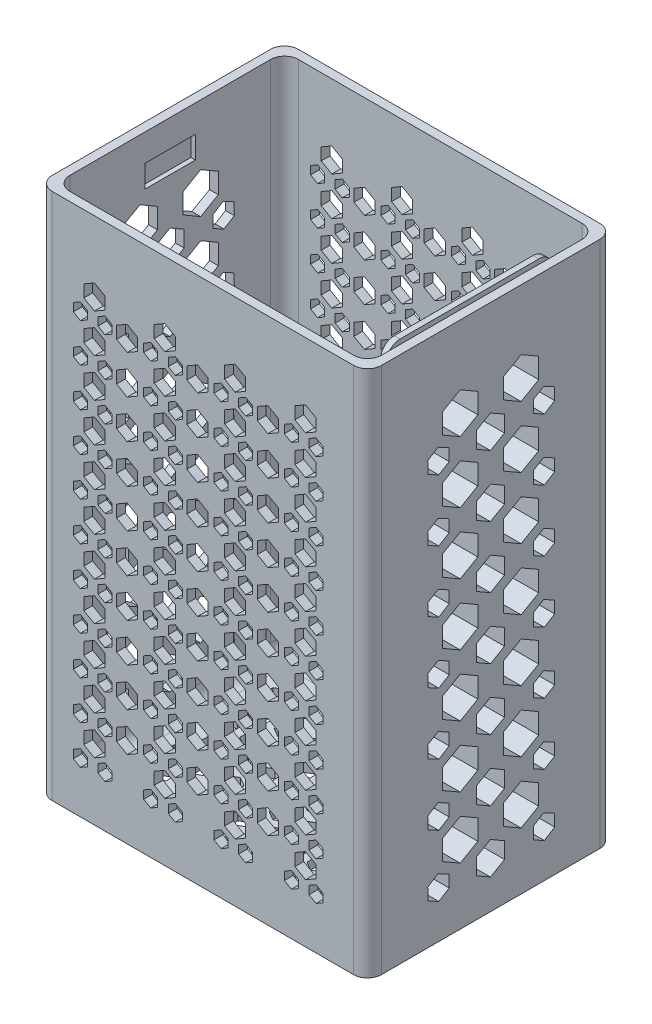
from build123d import *

# Parameters (mm, degrees)
SKETCH1_W                = 237.6932
SKETCH1_H                = 177.6984
SKETCH1_W_2              = 224.9932
SKETCH1_H_2              = 164.9984
BOSS_EXTRUDE1_DEPTH      = 374.65
SKETCH4_W                = 107.442
SKETCH4_H                = 374.65
BOSS_EXTRUDE2_DEPTH      = 9.017
SKETCH5_W                = 120.142
SKETCH5_H                = 374.65
BOSS_EXTRUDE3_DEPTH      = 4.191
SKETCH7_W                = 9.017
SKETCH7_H                = 107.442
CUT_EXTRUDE1_DEPTH       = 21.59
SKETCH10_W               = 4.191
SKETCH10_H               = 120.142
CUT_EXTRUDE2_DEPTH       = 5.588
FILLET1_R                = 10
FILLET2_R                = 10
FILLET3_R                = 10
FILLET4_R                = 10
FILLET5_R                = 10
FILLET6_R                = 10
FILLET7_R                = 10
SKETCH11_W               = 50.8
SKETCH11_H               = 15.24
BOSS_EXTRUDE4_DEPTH      = 19.9898
FILLET10_R               = 10
FILLET11_R               = 10
BOSS_EXTRUDE5_DEPTH      = 6.35
FILLET13_R               = 10
SKETCH13_W               = 36.3982
SKETCH13_H               = 16.129
CUT_EXTRUDE4_DEPTH       = 3.175
CUT_EXTRUDE5_DEPTH       = 6.35
CUT_EXTRUDE6_DEPTH       = 467.160768578
CUT_EXTRUDE6_DEPTH_BACK  = 467.160768578
CUT_EXTRUDE9_DEPTH       = 475.825252118
CUT_EXTRUDE9_DEPTH_BACK  = 475.825252118
CUT_EXTRUDE10_DEPTH      = 476.626906313
CUT_EXTRUDE10_DEPTH_BACK = 476.626906313
CUT_EXTRUDE11_DEPTH      = 476.626906313
CUT_EXTRUDE11_DEPTH_BACK = 476.626906313
CUT_EXTRUDE12_DEPTH      = 475.825252118
CUT_EXTRUDE12_DEPTH_BACK = 475.825252118


with BuildPart() as part:
    # Sketch1 → Boss-Extrude1 (new body)
    with BuildSketch(Plane(origin=(0, 0, 0), x_dir=(1, 0, 0), z_dir=(0, 1, 0))):
        with Locations((112.4966, -82.4992)):
            Rectangle(SKETCH1_W, SKETCH1_H)
        with Locations((112.4966, -82.4992)):
            Rectangle(SKETCH1_W_2, SKETCH1_H_2, mode=Mode.SUBTRACT)
    extrude(amount=BOSS_EXTRUDE1_DEPTH)

    # Sketch4 → Boss-Extrude2 (add)
    with BuildSketch(Plane.ZY.offset(-224.9932)):
        with Locations((82.4484, 187.325)):
            Rectangle(SKETCH4_W, SKETCH4_H)
    extrude(amount=BOSS_EXTRUDE2_DEPTH)

    # Sketch5 → Boss-Extrude3 (add)
    with BuildSketch(Plane.ZY.offset(-215.9762)):
        with Locations((82.4484, 187.325)):
            Rectangle(SKETCH5_W, SKETCH5_H)
    extrude(amount=BOSS_EXTRUDE3_DEPTH)

    # Sketch7 → Cut-Extrude1 (cut)
    with BuildSketch(Plane(origin=(0, 374.65, 0), x_dir=(1, 0, 0), z_dir=(0, 1, 0))):
        with Locations((220.4847, -82.4484)):
            Rectangle(SKETCH7_W, SKETCH7_H)
    extrude(amount=-CUT_EXTRUDE1_DEPTH, mode=Mode.SUBTRACT)

    # Sketch10 → Cut-Extrude2 (cut)
    with BuildSketch(Plane(origin=(0, 374.65, 0), x_dir=(1, 0, 0), z_dir=(0, 1, 0))):
        with Locations((213.8807, -82.4484)):
            Rectangle(SKETCH10_W, SKETCH10_H)
    extrude(amount=-CUT_EXTRUDE2_DEPTH, mode=Mode.SUBTRACT)

    # Fillet1
    fillet1_edges = [part.edges().sort_by_distance(p)[0] for p in [
        (231.3432, 187.325, 171.3484),
    ]]
    fillet(fillet1_edges, radius=FILLET1_R)

    # Fillet2
    fillet2_edges = [part.edges().sort_by_distance(p)[0] for p in [
        (224.9932, 187.325, 164.9984),
    ]]
    fillet(fillet2_edges, radius=FILLET2_R)

    # Fillet3
    fillet3_edges = [part.edges().sort_by_distance(p)[0] for p in [
        (224.9932, 187.325, 0),
        (231.3432, 187.325, -6.35),
    ]]
    fillet(fillet3_edges, radius=FILLET3_R)

    # Fillet4
    fillet4_edges = [part.edges().sort_by_distance(p)[0] for p in [
        (0, 187.325, 164.9984),
        (-6.35, 187.325, 171.3484),
    ]]
    fillet(fillet4_edges, radius=FILLET4_R)

    # Fillet5
    fillet5_edges = [part.edges().sort_by_distance(p)[0] for p in [
        (0, 187.325, 0),
        (-6.35, 187.325, -6.35),
    ]]
    fillet(fillet5_edges, radius=FILLET5_R)

    # Fillet6
    fillet6_edges = [part.edges().sort_by_distance(p)[0] for p in [
        (220.4847, 353.06, 28.7274),
        (220.4847, 353.06, 136.1694),
    ]]
    fillet(fillet6_edges, radius=FILLET6_R)

    # Fillet7
    fillet7_edges = [part.edges().sort_by_distance(p)[0] for p in [
        (213.8807, 369.062, 22.3774),
        (213.8807, 369.062, 142.5194),
    ]]
    fillet(fillet7_edges, radius=FILLET7_R)

    # Sketch11 → Boss-Extrude4 (add)
    with BuildSketch(Plane.ZY.offset(-211.7852)):
        with Locations((82.4484, 7.62)):
            Rectangle(SKETCH11_W, SKETCH11_H)
    extrude(amount=BOSS_EXTRUDE4_DEPTH)

    # Fillet10
    fillet10_edges = [part.edges().sort_by_distance(p)[0] for p in [
        (191.7954, 7.62, 57.0484),
        (191.7954, 7.62, 107.8484),
    ]]
    fillet(fillet10_edges, radius=FILLET10_R)

    # Fillet11
    fillet11_edges = [part.edges().sort_by_distance(p)[0] for p in [
        (191.7954, 15.24, 82.4484),
        (206.7903, 15.24, 57.0484),
        (206.7903, 15.24, 107.8484),
        (194.724332188, 15.24, 59.977332188),
        (194.724332188, 15.24, 104.919467812),
    ]]
    fillet(fillet11_edges, radius=FILLET11_R)

    # Sketch12 → Boss-Extrude5 (add)
    with BuildSketch(Plane.XZ):
        with BuildLine():
            Line((231.3432, 161.3484), (231.3432, 3.65))
            ThreePointArc((231.3432, 3.65), (228.414267812, -3.421067812), (221.3432, -6.35))
            Line((221.3432, -6.35), (3.65, -6.35))
            ThreePointArc((3.65, -6.35), (-3.421067812, -3.421067812), (-6.35, 3.65))
            Line((-6.35, 3.65), (-6.35, 161.3484))
            ThreePointArc((-6.35, 161.3484), (-3.421067812, 168.419467812), (3.65, 171.3484))
            Line((3.65, 171.3484), (221.3432, 171.3484))
            ThreePointArc((221.3432, 171.3484), (228.414267812, 168.419467812), (231.3432, 161.3484))
        make_face()
    extrude(amount=BOSS_EXTRUDE5_DEPTH)

    # Fillet13
    fillet13_edges = [part.edges().sort_by_distance(p)[0] for p in [
        (224.9932, 0, 19.3637),
        (222.064267812, 0, 2.928932188),
        (112.4966, 0, 0),
        (2.928932188, 0, 2.928932188),
        (224.9932, 0, 145.5839),
        (222.064267812, 0, 162.069467812),
        (112.4966, 0, 164.9984),
        (2.928932188, 0, 162.069467812),
        (0, 0, 82.4992),
    ]]
    fillet(fillet13_edges, radius=FILLET13_R)

    # Sketch13 → Cut-Extrude4 (cut)
    with BuildSketch(Plane(origin=(0, 0, 0), x_dir=(0, 0, -1), z_dir=(1, 0, 0))):
        with Locations((-82.5551, 346.9767)):
            Rectangle(SKETCH13_W, SKETCH13_H)
    extrude(amount=-CUT_EXTRUDE4_DEPTH, mode=Mode.SUBTRACT)

    # Sketch15 → Cut-Extrude5 (cut)
    with BuildSketch(Plane.XZ.offset(6.35)):
        Polygon((177.8, 131.139877372), (184.15, 134.806051581), (184.15, 142.1384), (177.8, 145.80457421), (171.45, 142.1384), (171.45, 134.806051581), align=None)
        Polygon((196.85, 131.139877372), (203.2, 134.806051581), (203.2, 142.1384), (196.85, 145.80457421), (190.5, 142.1384), (190.5, 134.806051581), align=None)
        Polygon((158.75, 131.139877372), (165.1, 134.806051581), (165.1, 142.1384), (158.75, 145.80457421), (152.4, 142.1384), (152.4, 134.806051581), align=None)
        Polygon((139.7, 131.139877372), (146.05, 134.806051581), (146.05, 142.1384), (139.7, 145.80457421), (133.35, 142.1384), (133.35, 134.806051581), align=None)
        Polygon((120.65, 131.139877372), (127, 134.806051581), (127, 142.1384), (120.65, 145.80457421), (114.3, 142.1384), (114.3, 134.806051581), align=None)
        Polygon((101.6, 131.139877372), (107.95, 134.806051581), (107.95, 142.1384), (101.6, 145.80457421), (95.25, 142.1384), (95.25, 134.806051581), align=None)
        Polygon((82.55, 131.139877372), (88.9, 134.806051581), (88.9, 142.1384), (82.55, 145.80457421), (76.2, 142.1384), (76.2, 134.806051581), align=None)
        Polygon((63.5, 131.139877372), (69.85, 134.806051581), (69.85, 142.1384), (63.5, 145.80457421), (57.15, 142.1384), (57.15, 134.806051581), align=None)
        Polygon((44.45, 131.139877372), (50.8, 134.806051581), (50.8, 142.1384), (44.45, 145.80457421), (38.1, 142.1384), (38.1, 134.806051581), align=None)
        Polygon((25.4, 131.139877372), (31.75, 134.806051581), (31.75, 142.1384), (25.4, 145.80457421), (19.05, 142.1384), (19.05, 134.806051581), align=None)
        Polygon((32.471566581, 113.225602985), (38.821566581, 116.891777194), (38.821566581, 124.224125613), (32.471566581, 127.890299822), (26.121566581, 124.224125613), (26.121566581, 116.891777194), align=None)
        Polygon((51.521566581, 113.225602985), (57.871566581, 116.891777194), (57.871566581, 124.224125613), (51.521566581, 127.890299822), (45.171566581, 124.224125613), (45.171566581, 116.891777194), align=None)
        Polygon((70.571566581, 113.225602985), (76.921566581, 116.891777194), (76.921566581, 124.224125613), (70.571566581, 127.890299822), (64.221566581, 124.224125613), (64.221566581, 116.891777194), align=None)
        Polygon((89.621566581, 113.225602985), (95.971566581, 116.891777194), (95.971566581, 124.224125613), (89.621566581, 127.890299822), (83.271566581, 124.224125613), (83.271566581, 116.891777194), align=None)
        Polygon((108.671566581, 113.225602985), (115.021566581, 116.891777194), (115.021566581, 124.224125613), (108.671566581, 127.890299822), (102.321566581, 124.224125613), (102.321566581, 116.891777194), align=None)
        Polygon((127.721566581, 113.225602985), (134.071566581, 116.891777194), (134.071566581, 124.224125613), (127.721566581, 127.890299822), (121.371566581, 124.224125613), (121.371566581, 116.891777194), align=None)
        Polygon((146.771566581, 113.225602985), (153.121566581, 116.891777194), (153.121566581, 124.224125613), (146.771566581, 127.890299822), (140.421566581, 124.224125613), (140.421566581, 116.891777194), align=None)
        Polygon((165.821566581, 113.225602985), (172.171566581, 116.891777194), (172.171566581, 124.224125613), (165.821566581, 127.890299822), (159.471566581, 124.224125613), (159.471566581, 116.891777194), align=None)
        Polygon((184.871566581, 113.225602985), (191.221566581, 116.891777194), (191.221566581, 124.224125613), (184.871566581, 127.890299822), (178.521566581, 124.224125613), (178.521566581, 116.891777194), align=None)
        Polygon((25.4, 95.311328598), (31.75, 98.977502807), (31.75, 106.309851226), (25.4, 109.976025435), (19.05, 106.309851226), (19.05, 98.977502807), align=None)
        Polygon((44.45, 95.311328598), (50.8, 98.977502807), (50.8, 106.309851226), (44.45, 109.976025435), (38.1, 106.309851226), (38.1, 98.977502807), align=None)
        Polygon((63.5, 95.311328598), (69.85, 98.977502807), (69.85, 106.309851226), (63.5, 109.976025435), (57.15, 106.309851226), (57.15, 98.977502807), align=None)
        Polygon((82.55, 95.311328598), (88.9, 98.977502807), (88.9, 106.309851226), (82.55, 109.976025435), (76.2, 106.309851226), (76.2, 98.977502807), align=None)
        Polygon((101.6, 95.311328598), (107.95, 98.977502807), (107.95, 106.309851226), (101.6, 109.976025435), (95.25, 106.309851226), (95.25, 98.977502807), align=None)
        Polygon((120.65, 95.311328598), (127, 98.977502807), (127, 106.309851226), (120.65, 109.976025435), (114.3, 106.309851226), (114.3, 98.977502807), align=None)
        Polygon((139.7, 95.311328598), (146.05, 98.977502807), (146.05, 106.309851226), (139.7, 109.976025435), (133.35, 106.309851226), (133.35, 98.977502807), align=None)
        Polygon((158.75, 95.311328598), (165.1, 98.977502807), (165.1, 106.309851226), (158.75, 109.976025435), (152.4, 106.309851226), (152.4, 98.977502807), align=None)
        Polygon((177.8, 95.311328598), (184.15, 98.977502807), (184.15, 106.309851226), (177.8, 109.976025435), (171.45, 106.309851226), (171.45, 98.977502807), align=None)
        Polygon((184.871566581, 77.397054211), (191.221566581, 81.06322842), (191.221566581, 88.395576839), (184.871566581, 92.061751048), (178.521566581, 88.395576839), (178.521566581, 81.06322842), align=None)
        Polygon((165.821566581, 77.397054211), (172.171566581, 81.06322842), (172.171566581, 88.395576839), (165.821566581, 92.061751048), (159.471566581, 88.395576839), (159.471566581, 81.06322842), align=None)
        Polygon((146.771566581, 77.397054211), (153.121566581, 81.06322842), (153.121566581, 88.395576839), (146.771566581, 92.061751048), (140.421566581, 88.395576839), (140.421566581, 81.06322842), align=None)
        Polygon((127.721566581, 77.397054211), (134.071566581, 81.06322842), (134.071566581, 88.395576839), (127.721566581, 92.061751048), (121.371566581, 88.395576839), (121.371566581, 81.06322842), align=None)
        Polygon((108.671566581, 77.397054211), (115.021566581, 81.06322842), (115.021566581, 88.395576839), (108.671566581, 92.061751048), (102.321566581, 88.395576839), (102.321566581, 81.06322842), align=None)
        Polygon((89.621566581, 77.397054211), (95.971566581, 81.06322842), (95.971566581, 88.395576839), (89.621566581, 92.061751048), (83.271566581, 88.395576839), (83.271566581, 81.06322842), align=None)
        Polygon((70.571566581, 77.397054211), (76.921566581, 81.06322842), (76.921566581, 88.395576839), (70.571566581, 92.061751048), (64.221566581, 88.395576839), (64.221566581, 81.06322842), align=None)
        Polygon((51.521566581, 77.397054211), (57.871566581, 81.06322842), (57.871566581, 88.395576839), (51.521566581, 92.061751048), (45.171566581, 88.395576839), (45.171566581, 81.06322842), align=None)
        Polygon((32.471566581, 77.397054211), (38.821566581, 81.06322842), (38.821566581, 88.395576839), (32.471566581, 92.061751048), (26.121566581, 88.395576839), (26.121566581, 81.06322842), align=None)
        Polygon((25.4, 59.482779824), (31.75, 63.148954033), (31.75, 70.481302452), (25.4, 74.147476661), (19.05, 70.481302452), (19.05, 63.148954033), align=None)
        Polygon((44.45, 59.482779824), (50.8, 63.148954033), (50.8, 70.481302452), (44.45, 74.147476661), (38.1, 70.481302452), (38.1, 63.148954033), align=None)
        Polygon((63.5, 59.482779824), (69.85, 63.148954033), (69.85, 70.481302452), (63.5, 74.147476661), (57.15, 70.481302452), (57.15, 63.148954033), align=None)
        Polygon((82.55, 59.482779824), (88.9, 63.148954033), (88.9, 70.481302452), (82.55, 74.147476661), (76.2, 70.481302452), (76.2, 63.148954033), align=None)
        Polygon((101.6, 59.482779824), (107.95, 63.148954033), (107.95, 70.481302452), (101.6, 74.147476661), (95.25, 70.481302452), (95.25, 63.148954033), align=None)
        Polygon((120.65, 59.482779824), (127, 63.148954033), (127, 70.481302452), (120.65, 74.147476661), (114.3, 70.481302452), (114.3, 63.148954033), align=None)
        Polygon((139.7, 59.482779824), (146.05, 63.148954033), (146.05, 70.481302452), (139.7, 74.147476661), (133.35, 70.481302452), (133.35, 63.148954033), align=None)
        Polygon((158.75, 59.482779824), (165.1, 63.148954033), (165.1, 70.481302452), (158.75, 74.147476661), (152.4, 70.481302452), (152.4, 63.148954033), align=None)
        Polygon((177.8, 59.482779824), (184.15, 63.148954033), (184.15, 70.481302452), (177.8, 74.147476661), (171.45, 70.481302452), (171.45, 63.148954033), align=None)
        Polygon((184.871566581, 41.568505436), (191.221566581, 45.234679646), (191.221566581, 52.567028064), (184.871566581, 56.233202274), (178.521566581, 52.567028064), (178.521566581, 45.234679646), align=None)
        Polygon((165.821566581, 41.568505436), (172.171566581, 45.234679646), (172.171566581, 52.567028064), (165.821566581, 56.233202274), (159.471566581, 52.567028064), (159.471566581, 45.234679646), align=None)
        Polygon((146.771566581, 41.568505436), (153.121566581, 45.234679646), (153.121566581, 52.567028064), (146.771566581, 56.233202274), (140.421566581, 52.567028064), (140.421566581, 45.234679646), align=None)
        Polygon((127.721566581, 41.568505436), (134.071566581, 45.234679646), (134.071566581, 52.567028064), (127.721566581, 56.233202274), (121.371566581, 52.567028064), (121.371566581, 45.234679646), align=None)
        Polygon((108.671566581, 41.568505436), (115.021566581, 45.234679646), (115.021566581, 52.567028064), (108.671566581, 56.233202274), (102.321566581, 52.567028064), (102.321566581, 45.234679646), align=None)
        Polygon((89.621566581, 41.568505436), (95.971566581, 45.234679646), (95.971566581, 52.567028064), (89.621566581, 56.233202274), (83.271566581, 52.567028064), (83.271566581, 45.234679646), align=None)
        Polygon((70.571566581, 41.568505436), (76.921566581, 45.234679646), (76.921566581, 52.567028064), (70.571566581, 56.233202274), (64.221566581, 52.567028064), (64.221566581, 45.234679646), align=None)
        Polygon((51.521566581, 41.568505436), (57.871566581, 45.234679646), (57.871566581, 52.567028064), (51.521566581, 56.233202274), (45.171566581, 52.567028064), (45.171566581, 45.234679646), align=None)
        Polygon((32.471566581, 41.568505436), (38.821566581, 45.234679646), (38.821566581, 52.567028064), (32.471566581, 56.233202274), (26.121566581, 52.567028064), (26.121566581, 45.234679646), align=None)
        Polygon((25.4, 23.654231049), (31.75, 27.320405259), (31.75, 34.652753677), (25.4, 38.318927887), (19.05, 34.652753677), (19.05, 27.320405259), align=None)
        Polygon((44.45, 23.654231049), (50.8, 27.320405259), (50.8, 34.652753677), (44.45, 38.318927887), (38.1, 34.652753677), (38.1, 27.320405259), align=None)
        Polygon((63.5, 23.654231049), (69.85, 27.320405259), (69.85, 34.652753677), (63.5, 38.318927887), (57.15, 34.652753677), (57.15, 27.320405259), align=None)
        Polygon((82.55, 23.654231049), (88.9, 27.320405259), (88.9, 34.652753677), (82.55, 38.318927887), (76.2, 34.652753677), (76.2, 27.320405259), align=None)
        Polygon((101.6, 23.654231049), (107.95, 27.320405259), (107.95, 34.652753677), (101.6, 38.318927887), (95.25, 34.652753677), (95.25, 27.320405259), align=None)
        Polygon((120.65, 23.654231049), (127, 27.320405259), (127, 34.652753677), (120.65, 38.318927887), (114.3, 34.652753677), (114.3, 27.320405259), align=None)
        Polygon((139.7, 23.654231049), (146.05, 27.320405259), (146.05, 34.652753677), (139.7, 38.318927887), (133.35, 34.652753677), (133.35, 27.320405259), align=None)
        Polygon((158.75, 23.654231049), (165.1, 27.320405259), (165.1, 34.652753677), (158.75, 38.318927887), (152.4, 34.652753677), (152.4, 27.320405259), align=None)
        Polygon((177.8, 23.654231049), (184.15, 27.320405259), (184.15, 34.652753677), (177.8, 38.318927887), (171.45, 34.652753677), (171.45, 27.320405259), align=None)
        Polygon((196.85, 23.654231049), (203.2, 27.320405259), (203.2, 34.652753677), (196.85, 38.318927887), (190.5, 34.652753677), (190.5, 27.320405259), align=None)
    extrude(amount=-CUT_EXTRUDE5_DEPTH, mode=Mode.SUBTRACT)

    # Sketch18 → Cut-Extrude6 (cut, two sides: drawn at the far end of the back side and taken through both)
    with BuildSketch(Plane.ZY.offset(-211.7852).offset(-CUT_EXTRUDE6_DEPTH_BACK)):
        Polygon((73.1774, 323.629651581), (60.4774, 330.962), (47.7774, 323.629651581), (47.7774, 308.964954744), (60.4774, 301.632606325), (73.1774, 308.964954744), align=None)
        Polygon((117.1194, 323.629651581), (104.4194, 330.962), (91.7194, 323.629651581), (91.7194, 308.964954744), (104.4194, 301.632606325), (117.1194, 308.964954744), align=None)
        Polygon((73.1774, 279.179651581), (60.4774, 286.512), (47.7774, 279.179651581), (47.7774, 264.514954744), (60.4774, 257.182606325), (73.1774, 264.514954744), align=None)
        Polygon((73.1774, 234.729651581), (60.4774, 242.062), (47.7774, 234.729651581), (47.7774, 220.064954744), (60.4774, 212.732606325), (73.1774, 220.064954744), align=None)
        Polygon((73.1774, 190.279651581), (60.4774, 197.612), (47.7774, 190.279651581), (47.7774, 175.614954744), (60.4774, 168.282606325), (73.1774, 175.614954744), align=None)
        Polygon((73.1774, 145.829651581), (60.4774, 153.162), (47.7774, 145.829651581), (47.7774, 131.164954744), (60.4774, 123.832606325), (73.1774, 131.164954744), align=None)
        Polygon((73.1774, 101.379651581), (60.4774, 108.712), (47.7774, 101.379651581), (47.7774, 86.714954744), (60.4774, 79.382606325), (73.1774, 86.714954744), align=None)
        Polygon((73.1774, 56.929651581), (60.4774, 64.262), (47.7774, 56.929651581), (47.7774, 42.264954744), (60.4774, 34.932606325), (73.1774, 42.264954744), align=None)
        Polygon((117.1194, 279.179651581), (104.4194, 286.512), (91.7194, 279.179651581), (91.7194, 264.514954744), (104.4194, 257.182606325), (117.1194, 264.514954744), align=None)
        Polygon((117.1194, 234.729651581), (104.4194, 242.062), (91.7194, 234.729651581), (91.7194, 220.064954744), (104.4194, 212.732606325), (117.1194, 220.064954744), align=None)
        Polygon((117.1194, 190.279651581), (104.4194, 197.612), (91.7194, 190.279651581), (91.7194, 175.614954744), (104.4194, 168.282606325), (117.1194, 175.614954744), align=None)
        Polygon((117.1194, 145.829651581), (104.4194, 153.162), (91.7194, 145.829651581), (91.7194, 131.164954744), (104.4194, 123.832606325), (117.1194, 131.164954744), align=None)
        Polygon((117.1194, 101.379651581), (104.4194, 108.712), (91.7194, 101.379651581), (91.7194, 86.714954744), (104.4194, 79.382606325), (117.1194, 86.714954744), align=None)
        Polygon((117.1194, 56.929651581), (104.4194, 64.262), (91.7194, 56.929651581), (91.7194, 42.264954744), (104.4194, 34.932606325), (117.1194, 42.264954744), align=None)
    extrude(amount=CUT_EXTRUDE6_DEPTH + CUT_EXTRUDE6_DEPTH_BACK, mode=Mode.SUBTRACT)

    # Sketch23 → Cut-Extrude9 (cut, two sides: drawn at the far end of the back side and taken through both)
    with BuildSketch(Plane.XY.offset(171.3484).offset(-CUT_EXTRUDE9_DEPTH_BACK)):
        Polygon((34.13, 315.051181898), (41.75, 319.450590949), (41.75, 328.249409051), (34.13, 332.648818102), (26.51, 328.249409051), (26.51, 319.450590949), align=None)
        Polygon((41.75, 300.309409051), (34.13, 304.708818102), (26.51, 300.309409051), (26.51, 291.510590949), (34.13, 287.111181898), (41.75, 291.510590949), align=None)
        Polygon((41.75, 272.369409051), (34.13, 276.768818102), (26.51, 272.369409051), (26.51, 263.570590949), (34.13, 259.171181898), (41.75, 263.570590949), align=None)
        Polygon((41.75, 244.429409051), (34.13, 248.828818102), (26.51, 244.429409051), (26.51, 235.630590949), (34.13, 231.231181898), (41.75, 235.630590949), align=None)
        Polygon((41.75, 216.489409051), (34.13, 220.888818102), (26.51, 216.489409051), (26.51, 207.690590949), (34.13, 203.291181898), (41.75, 207.690590949), align=None)
        Polygon((41.75, 188.549409051), (34.13, 192.948818102), (26.51, 188.549409051), (26.51, 179.750590949), (34.13, 175.351181898), (41.75, 179.750590949), align=None)
        Polygon((41.75, 160.609409051), (34.13, 165.008818102), (26.51, 160.609409051), (26.51, 151.810590949), (34.13, 147.411181898), (41.75, 151.810590949), align=None)
        Polygon((41.75, 132.669409051), (34.13, 137.068818102), (26.51, 132.669409051), (26.51, 123.870590949), (34.13, 119.471181898), (41.75, 123.870590949), align=None)
        Polygon((41.75, 104.729409051), (34.13, 109.128818102), (26.51, 104.729409051), (26.51, 95.930590949), (34.13, 91.531181898), (41.75, 95.930590949), align=None)
        Polygon((41.75, 76.789409051), (34.13, 81.188818102), (26.51, 76.789409051), (26.51, 67.990590949), (34.13, 63.591181898), (41.75, 67.990590949), align=None)
        Polygon((41.75, 48.849409051), (34.13, 53.248818102), (26.51, 48.849409051), (26.51, 40.050590949), (34.13, 35.651181898), (41.75, 40.050590949), align=None)
        Polygon((65.376240404, 314.187335919), (57.756240404, 318.58674497), (50.136240404, 314.187335919), (50.136240404, 305.388517816), (57.756240404, 300.989108765), (65.376240404, 305.388517816), align=None)
        Polygon((65.376240404, 286.247335919), (57.756240404, 290.64674497), (50.136240404, 286.247335919), (50.136240404, 277.448517816), (57.756240404, 273.049108765), (65.376240404, 277.448517816), align=None)
        Polygon((65.376240404, 258.307335919), (57.756240404, 262.70674497), (50.136240404, 258.307335919), (50.136240404, 249.508517816), (57.756240404, 245.109108765), (65.376240404, 249.508517816), align=None)
        Polygon((65.376240404, 230.367335919), (57.756240404, 234.76674497), (50.136240404, 230.367335919), (50.136240404, 221.568517816), (57.756240404, 217.169108765), (65.376240404, 221.568517816), align=None)
        Polygon((65.376240404, 202.427335919), (57.756240404, 206.82674497), (50.136240404, 202.427335919), (50.136240404, 193.628517816), (57.756240404, 189.229108765), (65.376240404, 193.628517816), align=None)
        Polygon((65.376240404, 174.487335919), (57.756240404, 178.88674497), (50.136240404, 174.487335919), (50.136240404, 165.688517816), (57.756240404, 161.289108765), (65.376240404, 165.688517816), align=None)
        Polygon((65.376240404, 146.547335919), (57.756240404, 150.94674497), (50.136240404, 146.547335919), (50.136240404, 137.748517816), (57.756240404, 133.349108765), (65.376240404, 137.748517816), align=None)
        Polygon((65.376240404, 118.607335919), (57.756240404, 123.00674497), (50.136240404, 118.607335919), (50.136240404, 109.808517816), (57.756240404, 105.409108765), (65.376240404, 109.808517816), align=None)
        Polygon((65.376240404, 90.667335919), (57.756240404, 95.06674497), (50.136240404, 90.667335919), (50.136240404, 81.868517816), (57.756240404, 77.469108765), (65.376240404, 81.868517816), align=None)
        Polygon((65.376240404, 62.727335919), (57.756240404, 67.12674497), (50.136240404, 62.727335919), (50.136240404, 53.928517816), (57.756240404, 49.529108765), (65.376240404, 53.928517816), align=None)
        Polygon((84.93, 315.051181898), (92.55, 319.450590949), (92.55, 328.249409051), (84.93, 332.648818102), (77.31, 328.249409051), (77.31, 319.450590949), align=None)
        Polygon((92.55, 300.309409051), (84.93, 304.708818102), (77.31, 300.309409051), (77.31, 291.510590949), (84.93, 287.111181898), (92.55, 291.510590949), align=None)
        Polygon((92.55, 272.369409051), (84.93, 276.768818102), (77.31, 272.369409051), (77.31, 263.570590949), (84.93, 259.171181898), (92.55, 263.570590949), align=None)
        Polygon((92.55, 244.429409051), (84.93, 248.828818102), (77.31, 244.429409051), (77.31, 235.630590949), (84.93, 231.231181898), (92.55, 235.630590949), align=None)
        Polygon((92.55, 216.489409051), (84.93, 220.888818102), (77.31, 216.489409051), (77.31, 207.690590949), (84.93, 203.291181898), (92.55, 207.690590949), align=None)
        Polygon((92.55, 188.549409051), (84.93, 192.948818102), (77.31, 188.549409051), (77.31, 179.750590949), (84.93, 175.351181898), (92.55, 179.750590949), align=None)
        Polygon((92.55, 160.609409051), (84.93, 165.008818102), (77.31, 160.609409051), (77.31, 151.810590949), (84.93, 147.411181898), (92.55, 151.810590949), align=None)
        Polygon((92.55, 132.669409051), (84.93, 137.068818102), (77.31, 132.669409051), (77.31, 123.870590949), (84.93, 119.471181898), (92.55, 123.870590949), align=None)
        Polygon((92.55, 104.729409051), (84.93, 109.128818102), (77.31, 104.729409051), (77.31, 95.930590949), (84.93, 91.531181898), (92.55, 95.930590949), align=None)
        Polygon((92.55, 76.789409051), (84.93, 81.188818102), (77.31, 76.789409051), (77.31, 67.990590949), (84.93, 63.591181898), (92.55, 67.990590949), align=None)
        Polygon((92.55, 48.849409051), (84.93, 53.248818102), (77.31, 48.849409051), (77.31, 40.050590949), (84.93, 35.651181898), (92.55, 40.050590949), align=None)
        Polygon((116.176240404, 314.187335919), (108.556240404, 318.58674497), (100.936240404, 314.187335919), (100.936240404, 305.388517816), (108.556240404, 300.989108765), (116.176240404, 305.388517816), align=None)
        Polygon((116.176240404, 286.247335919), (108.556240404, 290.64674497), (100.936240404, 286.247335919), (100.936240404, 277.448517816), (108.556240404, 273.049108765), (116.176240404, 277.448517816), align=None)
        Polygon((116.176240404, 258.307335919), (108.556240404, 262.70674497), (100.936240404, 258.307335919), (100.936240404, 249.508517816), (108.556240404, 245.109108765), (116.176240404, 249.508517816), align=None)
        Polygon((116.176240404, 230.367335919), (108.556240404, 234.76674497), (100.936240404, 230.367335919), (100.936240404, 221.568517816), (108.556240404, 217.169108765), (116.176240404, 221.568517816), align=None)
        Polygon((116.176240404, 202.427335919), (108.556240404, 206.82674497), (100.936240404, 202.427335919), (100.936240404, 193.628517816), (108.556240404, 189.229108765), (116.176240404, 193.628517816), align=None)
        Polygon((116.176240404, 174.487335919), (108.556240404, 178.88674497), (100.936240404, 174.487335919), (100.936240404, 165.688517816), (108.556240404, 161.289108765), (116.176240404, 165.688517816), align=None)
        Polygon((116.176240404, 146.547335919), (108.556240404, 150.94674497), (100.936240404, 146.547335919), (100.936240404, 137.748517816), (108.556240404, 133.349108765), (116.176240404, 137.748517816), align=None)
        Polygon((116.176240404, 118.607335919), (108.556240404, 123.00674497), (100.936240404, 118.607335919), (100.936240404, 109.808517816), (108.556240404, 105.409108765), (116.176240404, 109.808517816), align=None)
        Polygon((116.176240404, 90.667335919), (108.556240404, 95.06674497), (100.936240404, 90.667335919), (100.936240404, 81.868517816), (108.556240404, 77.469108765), (116.176240404, 81.868517816), align=None)
        Polygon((116.176240404, 62.727335919), (108.556240404, 67.12674497), (100.936240404, 62.727335919), (100.936240404, 53.928517816), (108.556240404, 49.529108765), (116.176240404, 53.928517816), align=None)
        Polygon((135.73, 315.051181898), (143.35, 319.450590949), (143.35, 328.249409051), (135.73, 332.648818102), (128.11, 328.249409051), (128.11, 319.450590949), align=None)
        Polygon((143.35, 300.309409051), (135.73, 304.708818102), (128.11, 300.309409051), (128.11, 291.510590949), (135.73, 287.111181898), (143.35, 291.510590949), align=None)
        Polygon((143.35, 272.369409051), (135.73, 276.768818102), (128.11, 272.369409051), (128.11, 263.570590949), (135.73, 259.171181898), (143.35, 263.570590949), align=None)
        Polygon((143.35, 244.429409051), (135.73, 248.828818102), (128.11, 244.429409051), (128.11, 235.630590949), (135.73, 231.231181898), (143.35, 235.630590949), align=None)
        Polygon((143.35, 216.489409051), (135.73, 220.888818102), (128.11, 216.489409051), (128.11, 207.690590949), (135.73, 203.291181898), (143.35, 207.690590949), align=None)
        Polygon((143.35, 188.549409051), (135.73, 192.948818102), (128.11, 188.549409051), (128.11, 179.750590949), (135.73, 175.351181898), (143.35, 179.750590949), align=None)
        Polygon((143.35, 160.609409051), (135.73, 165.008818102), (128.11, 160.609409051), (128.11, 151.810590949), (135.73, 147.411181898), (143.35, 151.810590949), align=None)
        Polygon((143.35, 132.669409051), (135.73, 137.068818102), (128.11, 132.669409051), (128.11, 123.870590949), (135.73, 119.471181898), (143.35, 123.870590949), align=None)
        Polygon((143.35, 104.729409051), (135.73, 109.128818102), (128.11, 104.729409051), (128.11, 95.930590949), (135.73, 91.531181898), (143.35, 95.930590949), align=None)
        Polygon((143.35, 76.789409051), (135.73, 81.188818102), (128.11, 76.789409051), (128.11, 67.990590949), (135.73, 63.591181898), (143.35, 67.990590949), align=None)
        Polygon((143.35, 48.849409051), (135.73, 53.248818102), (128.11, 48.849409051), (128.11, 40.050590949), (135.73, 35.651181898), (143.35, 40.050590949), align=None)
        Polygon((166.976240404, 314.187335919), (159.356240404, 318.58674497), (151.736240404, 314.187335919), (151.736240404, 305.388517816), (159.356240404, 300.989108765), (166.976240404, 305.388517816), align=None)
        Polygon((166.976240404, 286.247335919), (159.356240404, 290.64674497), (151.736240404, 286.247335919), (151.736240404, 277.448517816), (159.356240404, 273.049108765), (166.976240404, 277.448517816), align=None)
        Polygon((166.976240404, 258.307335919), (159.356240404, 262.70674497), (151.736240404, 258.307335919), (151.736240404, 249.508517816), (159.356240404, 245.109108765), (166.976240404, 249.508517816), align=None)
        Polygon((166.976240404, 230.367335919), (159.356240404, 234.76674497), (151.736240404, 230.367335919), (151.736240404, 221.568517816), (159.356240404, 217.169108765), (166.976240404, 221.568517816), align=None)
        Polygon((166.976240404, 202.427335919), (159.356240404, 206.82674497), (151.736240404, 202.427335919), (151.736240404, 193.628517816), (159.356240404, 189.229108765), (166.976240404, 193.628517816), align=None)
        Polygon((166.976240404, 174.487335919), (159.356240404, 178.88674497), (151.736240404, 174.487335919), (151.736240404, 165.688517816), (159.356240404, 161.289108765), (166.976240404, 165.688517816), align=None)
        Polygon((166.976240404, 146.547335919), (159.356240404, 150.94674497), (151.736240404, 146.547335919), (151.736240404, 137.748517816), (159.356240404, 133.349108765), (166.976240404, 137.748517816), align=None)
        Polygon((166.976240404, 118.607335919), (159.356240404, 123.00674497), (151.736240404, 118.607335919), (151.736240404, 109.808517816), (159.356240404, 105.409108765), (166.976240404, 109.808517816), align=None)
        Polygon((166.976240404, 90.667335919), (159.356240404, 95.06674497), (151.736240404, 90.667335919), (151.736240404, 81.868517816), (159.356240404, 77.469108765), (166.976240404, 81.868517816), align=None)
        Polygon((166.976240404, 62.727335919), (159.356240404, 67.12674497), (151.736240404, 62.727335919), (151.736240404, 53.928517816), (159.356240404, 49.529108765), (166.976240404, 53.928517816), align=None)
        Polygon((186.53, 315.051181898), (194.15, 319.450590949), (194.15, 328.249409051), (186.53, 332.648818102), (178.91, 328.249409051), (178.91, 319.450590949), align=None)
        Polygon((194.15, 300.309409051), (186.53, 304.708818102), (178.91, 300.309409051), (178.91, 291.510590949), (186.53, 287.111181898), (194.15, 291.510590949), align=None)
        Polygon((194.15, 272.369409051), (186.53, 276.768818102), (178.91, 272.369409051), (178.91, 263.570590949), (186.53, 259.171181898), (194.15, 263.570590949), align=None)
        Polygon((194.15, 244.429409051), (186.53, 248.828818102), (178.91, 244.429409051), (178.91, 235.630590949), (186.53, 231.231181898), (194.15, 235.630590949), align=None)
        Polygon((194.15, 216.489409051), (186.53, 220.888818102), (178.91, 216.489409051), (178.91, 207.690590949), (186.53, 203.291181898), (194.15, 207.690590949), align=None)
        Polygon((194.15, 188.549409051), (186.53, 192.948818102), (178.91, 188.549409051), (178.91, 179.750590949), (186.53, 175.351181898), (194.15, 179.750590949), align=None)
        Polygon((194.15, 160.609409051), (186.53, 165.008818102), (178.91, 160.609409051), (178.91, 151.810590949), (186.53, 147.411181898), (194.15, 151.810590949), align=None)
        Polygon((194.15, 132.669409051), (186.53, 137.068818102), (178.91, 132.669409051), (178.91, 123.870590949), (186.53, 119.471181898), (194.15, 123.870590949), align=None)
        Polygon((194.15, 104.729409051), (186.53, 109.128818102), (178.91, 104.729409051), (178.91, 95.930590949), (186.53, 91.531181898), (194.15, 95.930590949), align=None)
        Polygon((194.15, 76.789409051), (186.53, 81.188818102), (178.91, 76.789409051), (178.91, 67.990590949), (186.53, 63.591181898), (194.15, 67.990590949), align=None)
        Polygon((194.15, 48.849409051), (186.53, 53.248818102), (178.91, 48.849409051), (178.91, 40.050590949), (186.53, 35.651181898), (194.15, 40.050590949), align=None)
    extrude(amount=CUT_EXTRUDE9_DEPTH + CUT_EXTRUDE9_DEPTH_BACK, mode=Mode.SUBTRACT)

    # Sketch24 → Cut-Extrude10 (cut, two sides: drawn at the far end of the back side and taken through both)
    with BuildSketch(Plane(origin=(231.3432, 0, 0), x_dir=(0, 0, -1), z_dir=(1, 0, 0)).offset(-CUT_EXTRUDE10_DEPTH_BACK)):
        Polygon((-72.4484, 255.224178876), (-82.6084, 261.090057611), (-92.7684, 255.224178876), (-92.7684, 243.492421406), (-82.6084, 237.626542671), (-72.4484, 243.492421406), align=None)
        Polygon((-82.6084, 282.076542671), (-72.4484, 287.942421406), (-72.4484, 299.674178876), (-82.6084, 305.540057611), (-92.7684, 299.674178876), (-92.7684, 287.942421406), align=None)
        Polygon((-72.4484, 210.774178876), (-82.6084, 216.640057611), (-92.7684, 210.774178876), (-92.7684, 199.042421406), (-82.6084, 193.176542671), (-72.4484, 199.042421406), align=None)
        Polygon((-72.4484, 166.324178876), (-82.6084, 172.190057611), (-92.7684, 166.324178876), (-92.7684, 154.592421406), (-82.6084, 148.726542671), (-72.4484, 154.592421406), align=None)
        Polygon((-72.4484, 121.874178876), (-82.6084, 127.740057611), (-92.7684, 121.874178876), (-92.7684, 110.142421406), (-82.6084, 104.276542671), (-72.4484, 110.142421406), align=None)
        Polygon((-72.4484, 77.424178876), (-82.6084, 83.290057611), (-92.7684, 77.424178876), (-92.7684, 65.692421406), (-82.6084, 59.826542671), (-72.4484, 65.692421406), align=None)
        Polygon((-72.4484, 32.974178876), (-82.6084, 38.840057611), (-92.7684, 32.974178876), (-92.7684, 21.242421406), (-82.6084, 15.376542671), (-72.4484, 21.242421406), align=None)
    extrude(amount=CUT_EXTRUDE10_DEPTH + CUT_EXTRUDE10_DEPTH_BACK, mode=Mode.SUBTRACT)

    # Sketch25 → Cut-Extrude11 (cut, two sides: drawn at the far end of the back side and taken through both)
    with BuildSketch(Plane(origin=(231.3432, 0, 0), x_dir=(0, 0, -1), z_dir=(1, 0, 0)).offset(-CUT_EXTRUDE11_DEPTH_BACK)):
        Polygon((-120.405794491, 303.038101784), (-127.891811311, 298.414385512), (-127.630563971, 289.619446637), (-119.883299809, 285.448224032), (-112.397282989, 290.071940304), (-112.658530329, 298.86687918), align=None)
        Polygon((-36.458530329, 298.86687918), (-44.205794491, 303.038101784), (-51.691811311, 298.414385512), (-51.430563971, 289.619446637), (-43.683299809, 285.448224032), (-36.197282989, 290.071940304), align=None)
        Polygon((-120.405794491, 258.588101784), (-127.891811311, 253.964385512), (-127.630563971, 245.169446637), (-119.883299809, 240.998224032), (-112.397282989, 245.621940304), (-112.658530329, 254.41687918), align=None)
        Polygon((-120.405794491, 214.138101784), (-127.891811311, 209.514385512), (-127.630563971, 200.719446637), (-119.883299809, 196.548224032), (-112.397282989, 201.171940304), (-112.658530329, 209.96687918), align=None)
        Polygon((-120.405794491, 169.688101784), (-127.891811311, 165.064385512), (-127.630563971, 156.269446637), (-119.883299809, 152.098224033), (-112.397282989, 156.721940304), (-112.658530329, 165.51687918), align=None)
        Polygon((-120.405794491, 125.238101784), (-127.891811311, 120.614385512), (-127.630563971, 111.819446637), (-119.883299809, 107.648224033), (-112.397282989, 112.271940304), (-112.658530329, 121.06687918), align=None)
        Polygon((-120.405794491, 80.788101784), (-127.891811311, 76.164385512), (-127.630563971, 67.369446637), (-119.883299809, 63.198224033), (-112.397282989, 67.821940304), (-112.658530329, 76.61687918), align=None)
        Polygon((-120.405794491, 36.338101784), (-127.891811311, 31.714385512), (-127.630563971, 22.919446637), (-119.883299809, 18.748224033), (-112.397282989, 23.371940304), (-112.658530329, 32.16687918), align=None)
        Polygon((-44.205794491, 258.588101784), (-51.691811311, 253.964385512), (-51.430563971, 245.169446637), (-43.683299809, 240.998224032), (-36.197282989, 245.621940304), (-36.458530329, 254.41687918), align=None)
        Polygon((-44.205794491, 214.138101784), (-51.691811311, 209.514385512), (-51.430563971, 200.719446637), (-43.683299809, 196.548224032), (-36.197282989, 201.171940304), (-36.458530329, 209.96687918), align=None)
        Polygon((-44.205794491, 169.688101784), (-51.691811311, 165.064385512), (-51.430563971, 156.269446637), (-43.683299809, 152.098224033), (-36.197282989, 156.721940304), (-36.458530329, 165.51687918), align=None)
        Polygon((-44.205794491, 125.238101784), (-51.691811311, 120.614385512), (-51.430563971, 111.819446637), (-43.683299809, 107.648224033), (-36.197282989, 112.271940304), (-36.458530329, 121.06687918), align=None)
        Polygon((-44.205794491, 80.788101784), (-51.691811311, 76.164385512), (-51.430563971, 67.369446637), (-43.683299809, 63.198224033), (-36.197282989, 67.821940304), (-36.458530329, 76.61687918), align=None)
        Polygon((-44.205794491, 36.338101784), (-51.691811311, 31.714385512), (-51.430563971, 22.919446637), (-43.683299809, 18.748224033), (-36.197282989, 23.371940304), (-36.458530329, 32.16687918), align=None)
    extrude(amount=CUT_EXTRUDE11_DEPTH + CUT_EXTRUDE11_DEPTH_BACK, mode=Mode.SUBTRACT)

    # Sketch26 → Cut-Extrude12 (cut, two sides: drawn at the far end of the back side and taken through both)
    with BuildSketch(Plane.XY.offset(171.3484).offset(-CUT_EXTRUDE12_DEPTH_BACK)):
        Polygon((41.75, 315.742130772), (36.67, 312.809191405), (36.67, 306.94331267), (41.75, 304.010373303), (46.83, 306.94331267), (46.83, 312.809191405), align=None)
        Polygon((92.55, 315.742130772), (87.47, 312.809191405), (87.47, 306.94331267), (92.55, 304.010373303), (97.63, 306.94331267), (97.63, 312.809191405), align=None)
        Polygon((143.35, 315.742130772), (138.27, 312.809191405), (138.27, 306.94331267), (143.35, 304.010373303), (148.43, 306.94331267), (148.43, 312.809191405), align=None)
        Polygon((194.15, 315.742130772), (189.07, 312.809191405), (189.07, 306.94331267), (194.15, 304.010373303), (199.23, 306.94331267), (199.23, 312.809191405), align=None)
        Polygon((92.55, 287.802130772), (87.47, 284.869191405), (87.47, 279.00331267), (92.55, 276.070373303), (97.63, 279.00331267), (97.63, 284.869191405), align=None)
        Polygon((143.35, 287.802130772), (138.27, 284.869191405), (138.27, 279.00331267), (143.35, 276.070373303), (148.43, 279.00331267), (148.43, 284.869191405), align=None)
        Polygon((194.15, 287.802130772), (189.07, 284.869191405), (189.07, 279.00331267), (194.15, 276.070373303), (199.23, 279.00331267), (199.23, 284.869191405), align=None)
        Polygon((92.55, 259.862130772), (87.47, 256.929191405), (87.47, 251.06331267), (92.55, 248.130373303), (97.63, 251.06331267), (97.63, 256.929191405), align=None)
        Polygon((143.35, 259.862130772), (138.27, 256.929191405), (138.27, 251.06331267), (143.35, 248.130373303), (148.43, 251.06331267), (148.43, 256.929191405), align=None)
        Polygon((194.15, 259.862130772), (189.07, 256.929191405), (189.07, 251.06331267), (194.15, 248.130373303), (199.23, 251.06331267), (199.23, 256.929191405), align=None)
        Polygon((92.55, 231.922130772), (87.47, 228.989191405), (87.47, 223.12331267), (92.55, 220.190373303), (97.63, 223.12331267), (97.63, 228.989191405), align=None)
        Polygon((143.35, 231.922130772), (138.27, 228.989191405), (138.27, 223.12331267), (143.35, 220.190373303), (148.43, 223.12331267), (148.43, 228.989191405), align=None)
        Polygon((194.15, 231.922130772), (189.07, 228.989191405), (189.07, 223.12331267), (194.15, 220.190373303), (199.23, 223.12331267), (199.23, 228.989191405), align=None)
        Polygon((92.55, 203.982130772), (87.47, 201.049191405), (87.47, 195.18331267), (92.55, 192.250373303), (97.63, 195.18331267), (97.63, 201.049191405), align=None)
        Polygon((143.35, 203.982130772), (138.27, 201.049191405), (138.27, 195.18331267), (143.35, 192.250373303), (148.43, 195.18331267), (148.43, 201.049191405), align=None)
        Polygon((194.15, 203.982130772), (189.07, 201.049191405), (189.07, 195.18331267), (194.15, 192.250373303), (199.23, 195.18331267), (199.23, 201.049191405), align=None)
        Polygon((92.55, 176.042130772), (87.47, 173.109191405), (87.47, 167.24331267), (92.55, 164.310373303), (97.63, 167.24331267), (97.63, 173.109191405), align=None)
        Polygon((143.35, 176.042130772), (138.27, 173.109191405), (138.27, 167.24331267), (143.35, 164.310373303), (148.43, 167.24331267), (148.43, 173.109191405), align=None)
        Polygon((194.15, 176.042130772), (189.07, 173.109191405), (189.07, 167.24331267), (194.15, 164.310373303), (199.23, 167.24331267), (199.23, 173.109191405), align=None)
        Polygon((92.55, 148.102130772), (87.47, 145.169191405), (87.47, 139.30331267), (92.55, 136.370373303), (97.63, 139.30331267), (97.63, 145.169191405), align=None)
        Polygon((143.35, 148.102130772), (138.27, 145.169191405), (138.27, 139.30331267), (143.35, 136.370373303), (148.43, 139.30331267), (148.43, 145.169191405), align=None)
        Polygon((194.15, 148.102130772), (189.07, 145.169191405), (189.07, 139.30331267), (194.15, 136.370373303), (199.23, 139.30331267), (199.23, 145.169191405), align=None)
        Polygon((92.55, 120.162130772), (87.47, 117.229191405), (87.47, 111.36331267), (92.55, 108.430373303), (97.63, 111.36331267), (97.63, 117.229191405), align=None)
        Polygon((143.35, 120.162130772), (138.27, 117.229191405), (138.27, 111.36331267), (143.35, 108.430373303), (148.43, 111.36331267), (148.43, 117.229191405), align=None)
        Polygon((194.15, 120.162130772), (189.07, 117.229191405), (189.07, 111.36331267), (194.15, 108.430373303), (199.23, 111.36331267), (199.23, 117.229191405), align=None)
        Polygon((92.55, 92.222130772), (87.47, 89.289191405), (87.47, 83.42331267), (92.55, 80.490373303), (97.63, 83.42331267), (97.63, 89.289191405), align=None)
        Polygon((143.35, 92.222130772), (138.27, 89.289191405), (138.27, 83.42331267), (143.35, 80.490373303), (148.43, 83.42331267), (148.43, 89.289191405), align=None)
        Polygon((194.15, 92.222130772), (189.07, 89.289191405), (189.07, 83.42331267), (194.15, 80.490373303), (199.23, 83.42331267), (199.23, 89.289191405), align=None)
        Polygon((92.55, 64.282130772), (87.47, 61.349191405), (87.47, 55.48331267), (92.55, 52.550373303), (97.63, 55.48331267), (97.63, 61.349191405), align=None)
        Polygon((143.35, 64.282130772), (138.27, 61.349191405), (138.27, 55.48331267), (143.35, 52.550373303), (148.43, 55.48331267), (148.43, 61.349191405), align=None)
        Polygon((194.15, 64.282130772), (189.07, 61.349191405), (189.07, 55.48331267), (194.15, 52.550373303), (199.23, 55.48331267), (199.23, 61.349191405), align=None)
        Polygon((92.55, 36.342130772), (87.47, 33.409191405), (87.47, 27.54331267), (92.55, 24.610373303), (97.63, 27.54331267), (97.63, 33.409191405), align=None)
        Polygon((143.35, 36.342130772), (138.27, 33.409191405), (138.27, 27.54331267), (143.35, 24.610373303), (148.43, 27.54331267), (148.43, 33.409191405), align=None)
        Polygon((194.15, 36.342130772), (189.07, 33.409191405), (189.07, 27.54331267), (194.15, 24.610373303), (199.23, 27.54331267), (199.23, 33.409191405), align=None)
        Polygon((41.75, 287.802130772), (36.67, 284.869191405), (36.67, 279.00331267), (41.75, 276.070373303), (46.83, 279.00331267), (46.83, 284.869191405), align=None)
        Polygon((41.75, 259.862130772), (36.67, 256.929191405), (36.67, 251.06331267), (41.75, 248.130373303), (46.83, 251.06331267), (46.83, 256.929191405), align=None)
        Polygon((41.75, 231.922130772), (36.67, 228.989191405), (36.67, 223.12331267), (41.75, 220.190373303), (46.83, 223.12331267), (46.83, 228.989191405), align=None)
        Polygon((41.75, 203.982130772), (36.67, 201.049191405), (36.67, 195.18331267), (41.75, 192.250373303), (46.83, 195.18331267), (46.83, 201.049191405), align=None)
        Polygon((41.75, 176.042130772), (36.67, 173.109191405), (36.67, 167.24331267), (41.75, 164.310373303), (46.83, 167.24331267), (46.83, 173.109191405), align=None)
        Polygon((41.75, 148.102130772), (36.67, 145.169191405), (36.67, 139.30331267), (41.75, 136.370373303), (46.83, 139.30331267), (46.83, 145.169191405), align=None)
        Polygon((41.75, 120.162130772), (36.67, 117.229191405), (36.67, 111.36331267), (41.75, 108.430373303), (46.83, 111.36331267), (46.83, 117.229191405), align=None)
        Polygon((41.75, 92.222130772), (36.67, 89.289191405), (36.67, 83.42331267), (41.75, 80.490373303), (46.83, 83.42331267), (46.83, 89.289191405), align=None)
        Polygon((41.75, 64.282130772), (36.67, 61.349191405), (36.67, 55.48331267), (41.75, 52.550373303), (46.83, 55.48331267), (46.83, 61.349191405), align=None)
        Polygon((41.75, 36.342130772), (36.67, 33.409191405), (36.67, 27.54331267), (41.75, 24.610373303), (46.83, 27.54331267), (46.83, 33.409191405), align=None)
        Polygon((74.77, 315.742130772), (69.69, 312.809191405), (69.69, 306.94331267), (74.77, 304.010373303), (79.85, 306.94331267), (79.85, 312.809191405), align=None)
        Polygon((74.77, 287.802130772), (69.69, 284.869191405), (69.69, 279.00331267), (74.77, 276.070373303), (79.85, 279.00331267), (79.85, 284.869191405), align=None)
        Polygon((74.77, 259.862130772), (69.69, 256.929191405), (69.69, 251.06331267), (74.77, 248.130373303), (79.85, 251.06331267), (79.85, 256.929191405), align=None)
        Polygon((74.77, 231.922130772), (69.69, 228.989191405), (69.69, 223.12331267), (74.77, 220.190373303), (79.85, 223.12331267), (79.85, 228.989191405), align=None)
        Polygon((74.77, 203.982130772), (69.69, 201.049191405), (69.69, 195.18331267), (74.77, 192.250373303), (79.85, 195.18331267), (79.85, 201.049191405), align=None)
        Polygon((74.77, 176.042130772), (69.69, 173.109191405), (69.69, 167.24331267), (74.77, 164.310373303), (79.85, 167.24331267), (79.85, 173.109191405), align=None)
        Polygon((74.77, 148.102130772), (69.69, 145.169191405), (69.69, 139.30331267), (74.77, 136.370373303), (79.85, 139.30331267), (79.85, 145.169191405), align=None)
        Polygon((74.77, 120.162130772), (69.69, 117.229191405), (69.69, 111.36331267), (74.77, 108.430373303), (79.85, 111.36331267), (79.85, 117.229191405), align=None)
        Polygon((74.77, 92.222130772), (69.69, 89.289191405), (69.69, 83.42331267), (74.77, 80.490373303), (79.85, 83.42331267), (79.85, 89.289191405), align=None)
        Polygon((74.77, 64.282130772), (69.69, 61.349191405), (69.69, 55.48331267), (74.77, 52.550373303), (79.85, 55.48331267), (79.85, 61.349191405), align=None)
        Polygon((74.77, 36.342130772), (69.69, 33.409191405), (69.69, 27.54331267), (74.77, 24.610373303), (79.85, 27.54331267), (79.85, 33.409191405), align=None)
        Polygon((125.57, 315.742130772), (120.49, 312.809191405), (120.49, 306.94331267), (125.57, 304.010373303), (130.65, 306.94331267), (130.65, 312.809191405), align=None)
        Polygon((125.57, 287.802130772), (120.49, 284.869191405), (120.49, 279.00331267), (125.57, 276.070373303), (130.65, 279.00331267), (130.65, 284.869191405), align=None)
        Polygon((125.57, 259.862130772), (120.49, 256.929191405), (120.49, 251.06331267), (125.57, 248.130373303), (130.65, 251.06331267), (130.65, 256.929191405), align=None)
        Polygon((125.57, 231.922130772), (120.49, 228.989191405), (120.49, 223.12331267), (125.57, 220.190373303), (130.65, 223.12331267), (130.65, 228.989191405), align=None)
        Polygon((125.57, 203.982130772), (120.49, 201.049191405), (120.49, 195.18331267), (125.57, 192.250373303), (130.65, 195.18331267), (130.65, 201.049191405), align=None)
        Polygon((125.57, 176.042130772), (120.49, 173.109191405), (120.49, 167.24331267), (125.57, 164.310373303), (130.65, 167.24331267), (130.65, 173.109191405), align=None)
        Polygon((125.57, 148.102130772), (120.49, 145.169191405), (120.49, 139.30331267), (125.57, 136.370373303), (130.65, 139.30331267), (130.65, 145.169191405), align=None)
        Polygon((125.57, 120.162130772), (120.49, 117.229191405), (120.49, 111.36331267), (125.57, 108.430373303), (130.65, 111.36331267), (130.65, 117.229191405), align=None)
        Polygon((125.57, 92.222130772), (120.49, 89.289191405), (120.49, 83.42331267), (125.57, 80.490373303), (130.65, 83.42331267), (130.65, 89.289191405), align=None)
        Polygon((125.57, 64.282130772), (120.49, 61.349191405), (120.49, 55.48331267), (125.57, 52.550373303), (130.65, 55.48331267), (130.65, 61.349191405), align=None)
        Polygon((125.57, 36.342130772), (120.49, 33.409191405), (120.49, 27.54331267), (125.57, 24.610373303), (130.65, 27.54331267), (130.65, 33.409191405), align=None)
        Polygon((176.37, 315.742130772), (171.29, 312.809191405), (171.29, 306.94331267), (176.37, 304.010373303), (181.45, 306.94331267), (181.45, 312.809191405), align=None)
        Polygon((176.37, 287.802130772), (171.29, 284.869191405), (171.29, 279.00331267), (176.37, 276.070373303), (181.45, 279.00331267), (181.45, 284.869191405), align=None)
        Polygon((176.37, 259.862130772), (171.29, 256.929191405), (171.29, 251.06331267), (176.37, 248.130373303), (181.45, 251.06331267), (181.45, 256.929191405), align=None)
        Polygon((176.37, 231.922130772), (171.29, 228.989191405), (171.29, 223.12331267), (176.37, 220.190373303), (181.45, 223.12331267), (181.45, 228.989191405), align=None)
        Polygon((176.37, 203.982130772), (171.29, 201.049191405), (171.29, 195.18331267), (176.37, 192.250373303), (181.45, 195.18331267), (181.45, 201.049191405), align=None)
        Polygon((176.37, 176.042130772), (171.29, 173.109191405), (171.29, 167.24331267), (176.37, 164.310373303), (181.45, 167.24331267), (181.45, 173.109191405), align=None)
        Polygon((176.37, 148.102130772), (171.29, 145.169191405), (171.29, 139.30331267), (176.37, 136.370373303), (181.45, 139.30331267), (181.45, 145.169191405), align=None)
        Polygon((176.37, 120.162130772), (171.29, 117.229191405), (171.29, 111.36331267), (176.37, 108.430373303), (181.45, 111.36331267), (181.45, 117.229191405), align=None)
        Polygon((176.37, 92.222130772), (171.29, 89.289191405), (171.29, 83.42331267), (176.37, 80.490373303), (181.45, 83.42331267), (181.45, 89.289191405), align=None)
        Polygon((176.37, 64.282130772), (171.29, 61.349191405), (171.29, 55.48331267), (176.37, 52.550373303), (181.45, 55.48331267), (181.45, 61.349191405), align=None)
        Polygon((176.37, 36.342130772), (171.29, 33.409191405), (171.29, 27.54331267), (176.37, 24.610373303), (181.45, 27.54331267), (181.45, 33.409191405), align=None)
        Polygon((23.97, 315.742130772), (18.89, 312.809191405), (18.89, 306.94331267), (23.97, 304.010373303), (29.05, 306.94331267), (29.05, 312.809191405), align=None)
        Polygon((23.97, 287.802130772), (18.89, 284.869191405), (18.89, 279.00331267), (23.97, 276.070373303), (29.05, 279.00331267), (29.05, 284.869191405), align=None)
        Polygon((23.97, 259.862130772), (18.89, 256.929191405), (18.89, 251.06331267), (23.97, 248.130373303), (29.05, 251.06331267), (29.05, 256.929191405), align=None)
        Polygon((23.97, 231.922130772), (18.89, 228.989191405), (18.89, 223.12331267), (23.97, 220.190373303), (29.05, 223.12331267), (29.05, 228.989191405), align=None)
        Polygon((23.97, 203.982130772), (18.89, 201.049191405), (18.89, 195.18331267), (23.97, 192.250373303), (29.05, 195.18331267), (29.05, 201.049191405), align=None)
        Polygon((23.97, 176.042130772), (18.89, 173.109191405), (18.89, 167.24331267), (23.97, 164.310373303), (29.05, 167.24331267), (29.05, 173.109191405), align=None)
        Polygon((23.97, 148.102130772), (18.89, 145.169191405), (18.89, 139.30331267), (23.97, 136.370373303), (29.05, 139.30331267), (29.05, 145.169191405), align=None)
        Polygon((23.97, 120.162130772), (18.89, 117.229191405), (18.89, 111.36331267), (23.97, 108.430373303), (29.05, 111.36331267), (29.05, 117.229191405), align=None)
        Polygon((23.97, 92.222130772), (18.89, 89.289191405), (18.89, 83.42331267), (23.97, 80.490373303), (29.05, 83.42331267), (29.05, 89.289191405), align=None)
        Polygon((23.97, 64.282130772), (18.89, 61.349191405), (18.89, 55.48331267), (23.97, 52.550373303), (29.05, 55.48331267), (29.05, 61.349191405), align=None)
        Polygon((23.97, 36.342130772), (18.89, 33.409191405), (18.89, 27.54331267), (23.97, 24.610373303), (29.05, 27.54331267), (29.05, 33.409191405), align=None)
    extrude(amount=CUT_EXTRUDE12_DEPTH + CUT_EXTRUDE12_DEPTH_BACK, mode=Mode.SUBTRACT)


solid = part.part
